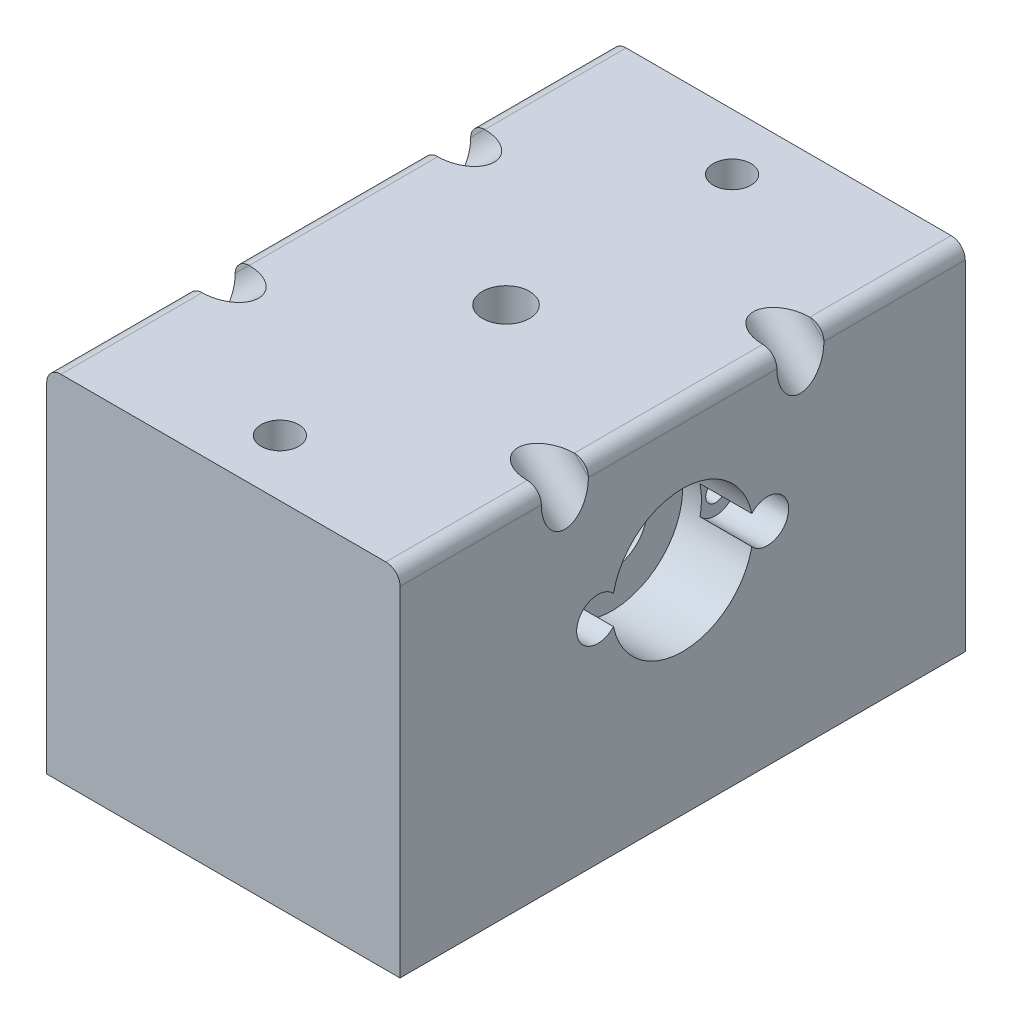
from build123d import *

# Parameters (mm, degrees)
SKETCH1_W                  = 75
SKETCH1_H                  = 75
BOSS_EXTRUDE1_DEPTH        = 60
SKETCH2_R                  = 5
CUT_EXTRUDE1_DEPTH         = 20
FILLET1_R                  = 3
CUT_EXTRUDE2_DEPTH         = 5
FILLET2_R                  = 5
FILLET2_OF_MIRROR1_R       = 5
MIRROR2_START              = -7.071067908
MIRROR2_DEPTH              = 14.142135816
SKETCH4_W                  = 25
SKETCH4_H                  = 20
CUT_EXTRUDE3_DEPTH         = 55
FILLET3_R                  = 5
CUT_EXTRUDE4_DEPTH         = 81.078087059
CUT_EXTRUDE4_DEPTH_BACK    = 81.078087059
SKETCH5_R                  = 7.5
SKETCH7_R                  = 15
CUT_EXTRUDE5_DEPTH         = 15
SKETCH8_R                  = 4.5
CUT_EXTRUDE6_DEPTH         = 11
M5_TAPPED_HOLE1_AT_2_COUNT = 2
M5_TAPPED_HOLE1_AT_2_PITCH = 36
M8_TAPPED_HOLE1_D          = 6.8
M8_TAPPED_HOLE1_DEPTH      = 19.75
M8_TAPPED_HOLE1_TIP        = 2.042926105
F_8_0MM_DOWEL_HOLE1_D      = 8


# Read off the part's stored shape, not the designer's step: Mirror2
with BuildPart() as part:
    # Sketch1 → Boss-Extrude1 (new, symmetric)
    with BuildSketch(Plane.XY):
        Rectangle(SKETCH1_W, SKETCH1_H)
    extrude(amount=BOSS_EXTRUDE1_DEPTH, both=True)

    # Sketch2 → Cut-Extrude1 (cut)
    with BuildSketch(Plane(origin=(0, 37.5, 0), x_dir=(1, 0, 0), z_dir=(0, 1, 0))):
        with Locations(Location((0, 0, 0), (0, 0, 270))):
            Circle(SKETCH2_R)
    extrude(amount=-CUT_EXTRUDE1_DEPTH, mode=Mode.SUBTRACT)

    # Fillet1
    fillet1_edges = [part.edges().sort_by_distance(p)[0] for p in [
        (-37.5, 37.5, 0),
        (37.5, 37.5, 0),
    ]]
    fillet(fillet1_edges, radius=FILLET1_R)

    # Sketch3 → Cut-Extrude2 (cut, symmetric)
    with BuildSketch(Plane.XY.offset(-25)):
        Polygon((-37.5, 27.5), (-27.5, 37.5), (-37.5, 37.5), align=None)
    cut_extrude2 = extrude(amount=CUT_EXTRUDE2_DEPTH, both=True, mode=Mode.SUBTRACT)

    # Fillet2
    fillet2_edges = [part.edges().sort_by_distance(p)[0] for p in [
        (-32.5, 32.5, -30),
        (-32.5, 32.5, -20),
    ]]
    fillet(fillet2_edges, radius=FILLET2_R - 0.0001)  # a hair under: the kernel refuses the full size

    # Mirror1: Cut-Extrude2 across plane
    add(cut_extrude2.mirror(Plane.XY), mode=Mode.SUBTRACT)

    # Fillet2 of Mirror1
    fillet2_of_mirror1_edges = [part.edges().sort_by_distance(p)[0] for p in [
        (-32.5, 32.5, 30),
        (-32.5, 32.5, 20),
    ]]
    fillet(fillet2_of_mirror1_edges, radius=FILLET2_OF_MIRROR1_R - 0.0001)  # a hair under: the kernel refuses the full size

    # Mirror2 outline → Mirror2 (cut)
    with BuildSketch(Plane(origin=(0, 0, 0), x_dir=(0.707106781186546, 0.707106781186549, 0), z_dir=(0.707106781186549, -0.707106781186546, 0)).offset(MIRROR2_START)):
        with BuildLine():
            ThreePointArc((50.961940783, 30.000000002), (45.961940781, 25), (50.961940783, 19.999999998))
            Line((50.961940783, 19.999999998), (53, 20))
            Line((53, 20), (53, 30))
            Line((53, 30), (50.961940783, 30.000000002))
        make_face()
        with BuildLine():
            Line((53, -30), (53, -20))
            Line((53, -20), (50.961940783, -19.999999998))
            ThreePointArc((50.961940783, -19.999999998), (45.961940781, -25), (50.961940783, -30.000000002))
            Line((50.961940783, -30.000000002), (53, -30))
        make_face()
    extrude(amount=MIRROR2_DEPTH, mode=Mode.SUBTRACT)

    # Sketch4 → Cut-Extrude3 (cut)
    with BuildSketch(Plane.XZ.offset(37.5)):
        Rectangle(SKETCH4_W, SKETCH4_H)
    extrude(amount=-CUT_EXTRUDE3_DEPTH, mode=Mode.SUBTRACT)

    # Fillet3
    fillet3_edges = [part.edges().sort_by_distance(p)[0] for p in [
        (12.5, 17.5, 0),
        (12.5, -10, 10),
        (0, 17.5, -10),
        (12.5, -10, -10),
        (-12.5, 17.5, 0),
        (-12.5, -10, -10),
        (0, 17.5, 10),
        (-12.5, -10, 10),
    ]]
    fillet(fillet3_edges, radius=FILLET3_R - 0.0001)  # a hair under: the kernel refuses the full size

    # Sketch5 → Cut-Extrude4 (cut, two sides: drawn at the far end of the back side and taken through both)
    with BuildSketch(Plane(origin=(0, 0, 0), x_dir=(0, 0, -1), z_dir=(1, 0, 0)).offset(-CUT_EXTRUDE4_DEPTH_BACK)):
        with Locations((0, 7.5)):
            Circle(SKETCH5_R)
    extrude(amount=CUT_EXTRUDE4_DEPTH + CUT_EXTRUDE4_DEPTH_BACK, mode=Mode.SUBTRACT)

    # Sketch7 → Cut-Extrude5 (cut)
    with BuildSketch(Plane.ZY.offset(37.5)):
        with Locations((0, 7.5)):
            Circle(SKETCH7_R)
    cut_extrude5 = extrude(amount=-CUT_EXTRUDE5_DEPTH, mode=Mode.SUBTRACT)

    # Mirror3: Cut-Extrude5 across plane
    add(cut_extrude5.mirror(Plane(origin=(0, 0, 0), x_dir=(0, 0, 1), z_dir=(1, 0, 0))), mode=Mode.SUBTRACT)

    # Sketch8 → Cut-Extrude6 (cut)
    with BuildSketch(Plane.ZY.offset(37.5)):
        with Locations((-18, 7.5)):
            Circle(SKETCH8_R)
        with Locations((18, 7.5)):
            Circle(SKETCH8_R)
    cut_extrude6 = extrude(amount=-CUT_EXTRUDE6_DEPTH, mode=Mode.SUBTRACT)

    # Sketch10 → M5 Tapped Hole1 (revolve, cut)
    with BuildSketch(Plane(origin=(-26.5, 7.5, -18), x_dir=(0, 0, 1), z_dir=(0, 1, 0))):
        Polygon((0, 0), (0, 13.6618073), (2.1, 12.4), (2.1, 0), align=None)
    m5_tapped_hole1 = revolve(axis=Axis((-32.85, 7.5, -18), (1, 0, 0)), mode=Mode.SUBTRACT)

    # M5 Tapped Hole1 at 2: M5 Tapped Hole1 ×2
    with Locations(*[(0, 0, i * M5_TAPPED_HOLE1_AT_2_PITCH) for i in range(1, M5_TAPPED_HOLE1_AT_2_COUNT)]):
        add(m5_tapped_hole1, mode=Mode.SUBTRACT)

    # Mirror4: Cut-Extrude6, M5 Tapped Hole1 across plane
    add(cut_extrude6.mirror(Plane(origin=(0, 0, 0), x_dir=(0, 0, 1), z_dir=(1, 0, 0))), mode=Mode.SUBTRACT)
    add(m5_tapped_hole1.mirror(Plane(origin=(0, 0, 0), x_dir=(0, 0, 1), z_dir=(1, 0, 0))), mode=Mode.SUBTRACT)

    # Mirror4 copy 1 sketch → Mirror4 copy 1 (revolve, cut)
    with BuildSketch(Plane(origin=(26.5, 7.5, 18), x_dir=(0, 0, 1), z_dir=(0, 1, 0))):
        Polygon((0, 0), (0, -13.6618073), (2.1, -12.4), (2.1, 0), align=None)
    revolve(axis=Axis((32.85, 7.5, 18), (1, 0, 0)), mode=Mode.SUBTRACT)

    # M8 Tapped Hole1
    with Locations(Plane(origin=(0, -37.5, 0), x_dir=(-1, 0, 0), z_dir=(0, -1, 0))):
        with Locations((-25.5, 48), (25.5, 48), (25.5, -48), (-25.5, -48)):
            Hole(M8_TAPPED_HOLE1_D / 2, depth=M8_TAPPED_HOLE1_DEPTH)
            with Locations((0, 0, -(M8_TAPPED_HOLE1_DEPTH + M8_TAPPED_HOLE1_TIP / 2))):  # 118° drill point
                Cone(0, M8_TAPPED_HOLE1_D / 2, M8_TAPPED_HOLE1_TIP, mode=Mode.SUBTRACT)

    # Ø8.0mm Dowel Hole1 (through all)
    with Locations(Plane(origin=(0, -37.5, 0), x_dir=(-1, 0, 0), z_dir=(0, -1, 0))):
        with Locations((0, 48), (0, -48)):
            Hole(F_8_0MM_DOWEL_HOLE1_D / 2)


solid = part.part
